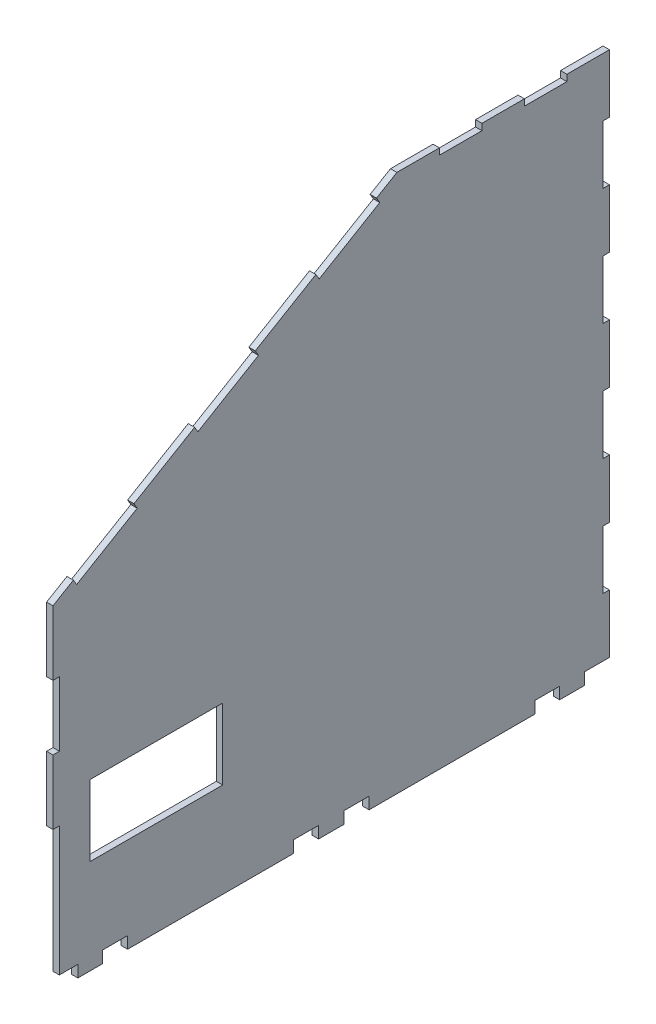
from build123d import *

# Parameters (mm, degrees)
BOSS_EXTRUDE1_DEPTH = 2.7


with BuildPart() as part:
    # Sketch1 → Boss-Extrude1 (new body)
    with BuildSketch(Plane(origin=(0, 0, 0), x_dir=(0, 0, -1), z_dir=(1, 0, 0))):
        Polygon((117.52, 87.8), (117.52, 112.5), (99.566, 112.5), (99.566, 109.8), (81.612, 109.8), (81.612, 112.5), (63.658, 112.5), (63.658, 109.8), (45.704, 109.8), (45.704, 112.5), (27.75, 112.5), (19.142256818, 107.410131897), (20.516521206, 105.086041238), (-5.094381521, 89.941988479), (-6.468645909, 92.266079138), (-32.079548636, 77.122026379), (-30.705284249, 74.79793572), (-56.316186976, 59.653882961), (-57.690451364, 61.977973621), (-83.301354091, 46.833920862), (-81.927089703, 44.509830203), (-107.53799243, 29.365777444), (-108.912256818, 31.689868103), (-117.52, 26.6), (-117.52, -0.68), (-114.82, -0.68), (-114.82, -27.96), (-117.52, -27.96), (-117.52, -55.24), (-114.82, -55.24), (-114.82, -82.52), (-114.82, -109.8), (-107.013333333, -109.8), (-107.013333333, -112.5), (-107.013333333, -114.8), (-96.506666667, -114.8), (-96.506666667, -112.5), (-96.506666667, -109.8), (-86, -109.8), (-86, -112.5), (-86, -114.8), (-16, -114.8), (-16, -112.5), (-16, -109.8), (-5.333333333, -109.8), (-5.333333333, -112.5), (-5.333333333, -114.8), (5.333333333, -114.8), (5.333333333, -112.5), (5.333333333, -109.8), (16, -109.8), (16, -112.5), (16, -114.8), (86, -114.8), (86, -112.5), (86, -109.8), (96.506666667, -109.8), (96.506666667, -112.5), (96.506666667, -114.8), (107.013333333, -114.8), (107.013333333, -112.5), (107.013333333, -109.8), (117.52, -109.8), (117.52, -85.1), (114.82, -85.1), (114.82, -60.4), (117.52, -60.4), (117.52, -35.7), (114.82, -35.7), (114.82, -11), (117.52, -11), (117.52, 13.7), (114.82, 13.7), (114.82, 38.4), (117.52, 38.4), (117.52, 63.1), (114.82, 63.1), (114.82, 87.8), align=None)
        Polygon((-101.82, -44.8), (-55.82, -44.8), (-45.82, -44.8), (-45.82, -74.8), (-55.82, -74.8), (-101.82, -74.8), align=None, mode=Mode.SUBTRACT)
    extrude(amount=BOSS_EXTRUDE1_DEPTH)


solid = part.part
